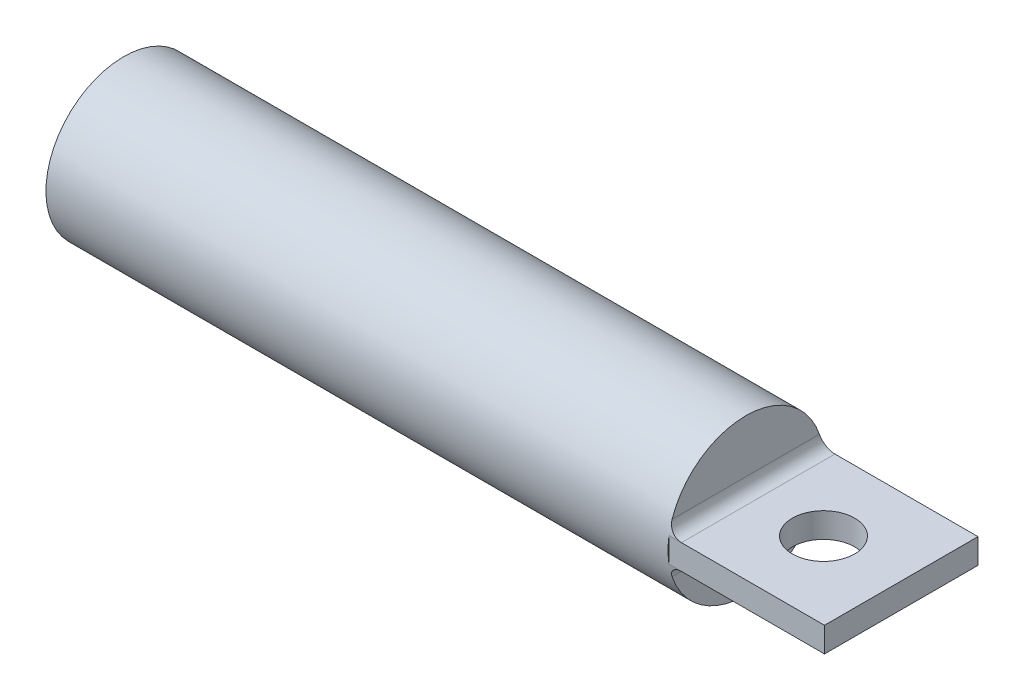
from build123d import *

# Parameters (mm, degrees)
SKETCH1_R           = 3.175
BOSS_EXTRUDE1_DEPTH = 25.4
SKETCH2_W           = 6.268193042
SKETCH2_H           = 1.016
BOSS_EXTRUDE2_DEPTH = 6.35
SKETCH3_R           = 1.27
CUT_EXTRUDE1_DEPTH  = 33.120205697
FILLET1_R           = 0.508


with BuildPart() as part:
    # Sketch1 → Boss-Extrude1 (new body)
    with BuildSketch(Plane(origin=(0, 0, 0), x_dir=(0, 0, -1), z_dir=(1, 0, 0))):
        Circle(SKETCH1_R)
    extrude(amount=BOSS_EXTRUDE1_DEPTH)

    # Sketch2 → Boss-Extrude2 (add)
    with BuildSketch(Plane(origin=(25.4, 0, 0), x_dir=(0, 0, -1), z_dir=(1, 0, 0))):
        Rectangle(SKETCH2_W, SKETCH2_H)
    extrude(amount=BOSS_EXTRUDE2_DEPTH)

    # Sketch3 → Cut-Extrude1 (cut, through all)
    with BuildSketch(Plane(origin=(0, 0.508, 0), x_dir=(1, 0, 0), z_dir=(0, 1, 0))):
        with Locations(Location((28.575, 0, 0), (0, 0, 270))):
            Circle(SKETCH3_R)
    extrude(amount=-CUT_EXTRUDE1_DEPTH, mode=Mode.SUBTRACT)

    # Fillet1
    # the kernel refuses this fillet: 0.508 mm, written as the material it adds along each edge
    with BuildSketch(Plane(origin=(25.4, -0.508, -3.134096521), x_dir=(0, -1, 0), z_dir=(0, 0, 1))) as fillet1_piece_1_section:
        with BuildLine():
            CenterArc((FILLET1_R, FILLET1_R), FILLET1_R, 180, 90)
            Line((0, FILLET1_R), (0, 0))
            Line((0, 0), (FILLET1_R, 0))
        make_face()
    fillet1_piece_1 = extrude(amount=6.268193041, mode=Mode.PRIVATE)
    fillet1_piece_1 = fillet1_piece_1 & Plane(origin=(25.515488837, 0, 0), x_dir=(0, 0, -1), z_dir=(-1, 0, 0)) * Cylinder(3.175, 15, mode=Mode.PRIVATE)
    add(fillet1_piece_1)
    with BuildSketch(Plane(origin=(25.4, 0.508, 3.134096521), x_dir=(0, 1, 0), z_dir=(0, 0, -1))) as fillet1_piece_2_section:
        with BuildLine():
            CenterArc((FILLET1_R, FILLET1_R), FILLET1_R, 180, 90)
            Line((0, FILLET1_R), (0, 0))
            Line((0, 0), (FILLET1_R, 0))
        make_face()
    fillet1_piece_2 = extrude(amount=6.268193041, mode=Mode.PRIVATE)
    fillet1_piece_2 = fillet1_piece_2 & Plane(origin=(25.515488837, 0, 0), x_dir=(0, 0, -1), z_dir=(-1, 0, 0)) * Cylinder(3.175, 15, mode=Mode.PRIVATE)
    add(fillet1_piece_2)


solid = part.part
